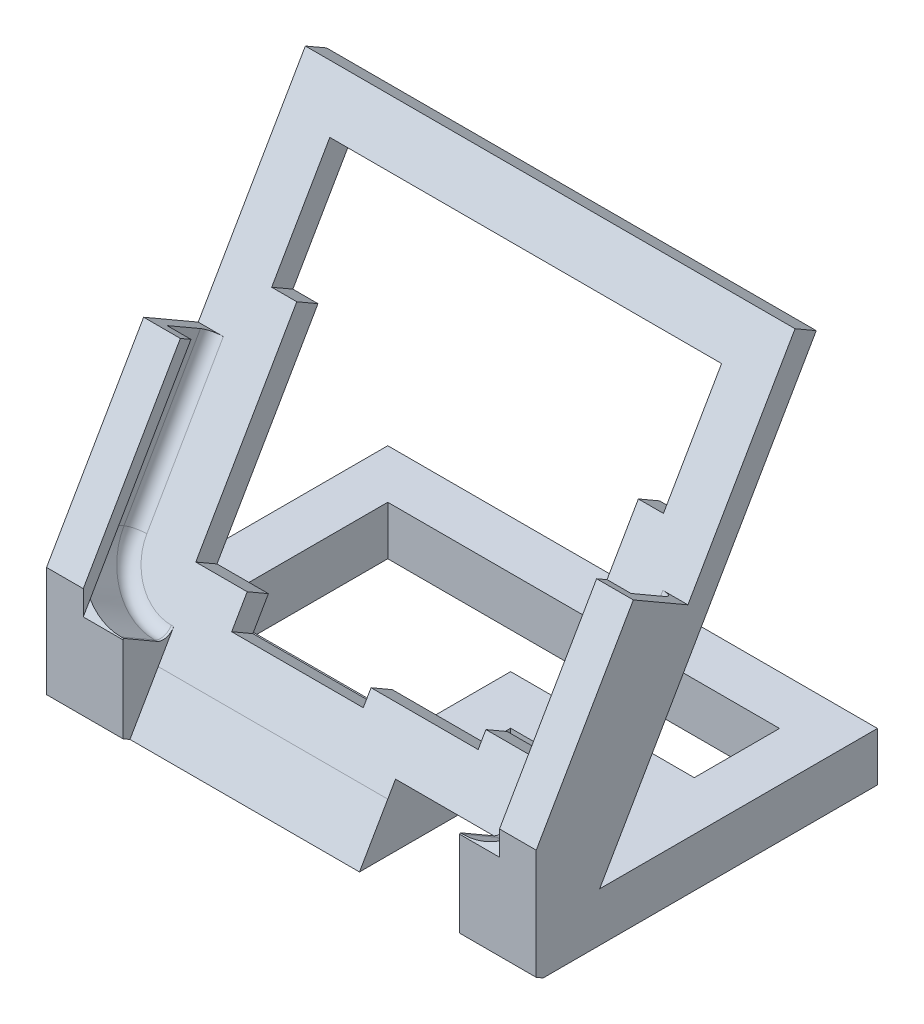
from build123d import *
from OCP.BRepFilletAPI import BRepFilletAPI_MakeChamfer

# Parameters (mm, degrees)
SKETCH1_W           = 80
SKETCH1_H           = 50
BOSS_EXTRUDE1_DEPTH = 8
BOSS_EXTRUDE2_DEPTH = 80
SKETCH3_W           = 2.1
SKETCH3_H           = 35
BOSS_EXTRUDE3_DEPTH = 8.3
FILLET1_R           = 10
FILLET2_R           = 2
BOSS_EXTRUDE4_DEPTH = 10
CHAMFER2_SIZE       = 17.320508076
CHAMFER2_SIZE_2     = 10
SKETCH5_W           = 12.5
SKETCH5_H           = 9.237604307
BOSS_EXTRUDE5_DEPTH = 8.3
SKETCH6_W           = 6
SKETCH6_H           = 47.309401077
BOSS_EXTRUDE6_DEPTH = 2
CHAMFER3_SIZE       = 9
CHAMFER3_SIZE2      = 15.588457268
SKETCH7_W           = 17.5
SKETCH7_H           = 11.773502692
CUT_EXTRUDE1_DEPTH  = 12
SKETCH8_W           = 17.5
SKETCH8_H           = 15
CUT_EXTRUDE2_DEPTH  = 12
CUT_EXTRUDE3_DEPTH  = 12
CUT_EXTRUDE4_DEPTH  = 4


with BuildPart() as part:
    # Sketch1 → Boss-Extrude1 (new body)
    with BuildSketch(Plane(origin=(0, 0, 0), x_dir=(1, 0, 0), z_dir=(0, 1, 0))):
        Rectangle(SKETCH1_W, SKETCH1_H)
    extrude(amount=BOSS_EXTRUDE1_DEPTH)

    # Sketch2 → Boss-Extrude2 (add)
    with BuildSketch(Plane(origin=(40, 0, 0), x_dir=(0, 0, -1), z_dir=(1, 0, 0))):
        Polygon((15, 69.282032303), (11.535898385, 71.282032303), (-25, 8), (-20.381197846, 8), align=None)
    extrude(amount=-BOSS_EXTRUDE2_DEPTH)

    # Sketch3 → Boss-Extrude3 (add)
    with BuildSketch(Plane(origin=(0, 12.825317547, 22.214101615), x_dir=(1, 0, 0), z_dir=(0, 0.5000000000000041, 0.8660254037844364))):
        with Locations((-38.95, 15)):
            Rectangle(SKETCH3_W, SKETCH3_H)
        Polygon((-27.5, -5.57179677), (-27.5, -2.5), (-37.9, -2.5), (-40, -2.5), (-40, -5.57179677), align=None)
        Polygon((40, -5.57179677), (40, -2.5), (37.9, -2.5), (27.5, -2.5), (27.5, -5.57179677), align=None)
        with Locations((38.95, 15)):
            Rectangle(SKETCH3_W, SKETCH3_H)
    extrude(amount=BOSS_EXTRUDE3_DEPTH)

    # Fillet1
    fillet1_edges = [part.edges().sort_by_distance(p)[0] for p in [
        (-37.9, 12.735254038, 27.058107041),
        (37.9, 12.735254038, 27.058107041),
    ]]
    fillet(fillet1_edges, radius=FILLET1_R)

    # Fillet2
    fillet2_edges = [part.edges().sort_by_distance(p)[0] for p in [
        (-27.7, 10.660254038, 23.464101615),
        (-37.9, 30.145825623, 12.214101615),
        (27.7, 10.660254038, 23.464101615),
        (37.9, 30.145825623, 12.214101615),
        (34.971067812, 13.196783719, 21.999635521),
        (-34.971067812, 13.196783719, 21.999635521),
    ]]
    fillet(fillet2_edges, radius=FILLET2_R)

    # Sketch4 → Boss-Extrude4 (add)
    with BuildSketch(Plane.XY.offset(25)):
        Polygon((40, 0), (40, 8), (27.5, 8), (-27.5, 8), (-40, 8), (-40, 0), align=None)
    extrude(amount=BOSS_EXTRUDE4_DEPTH)

    # Chamfer2
    # the kernel refuses this chamfer: 17.320508076, 10 mm, written as the material it takes off along each edge
    with BuildSketch(Plane(origin=(-84.809639706, 8, 35), x_dir=(0, -0.999813220622208, 0.019326765612700497), z_dir=(1, 0, 0))) as chamfer2_piece_1:
        Polygon((CHAMFER2_SIZE * 0.999813220604, CHAMFER2_SIZE * 0.0193267656124), (-CHAMFER2_SIZE_2 * 0.0193267656127, CHAMFER2_SIZE_2 * 0.999813220622), (0, 0), align=None)
    extrude(amount=169.619279412, mode=Mode.SUBTRACT)

    # Sketch5 → Boss-Extrude5 (add)
    with BuildSketch(Plane(origin=(0, 12.825317547, 22.214101615), x_dir=(1, 0, 0), z_dir=(0, 0.49999999999999656, 0.8660254037844407))):
        with Locations((-33.75, -10.190598924)):
            Rectangle(SKETCH5_W, SKETCH5_H)
        with Locations((33.75, -10.190598924)):
            Rectangle(SKETCH5_W, SKETCH5_H)
    extrude(amount=BOSS_EXTRUDE5_DEPTH)

    # Sketch6 → Boss-Extrude6 (add)
    with BuildSketch(Plane(origin=(0, 16.975317547, 29.402112467), x_dir=(1, 0, 0), z_dir=(0, 0.5000000000000041, 0.8660254037844364))):
        with Locations((-37, 8.845299461)):
            Rectangle(SKETCH6_W, SKETCH6_H)
        with Locations((37, 8.845299461)):
            Rectangle(SKETCH6_W, SKETCH6_H)
    extrude(amount=BOSS_EXTRUDE6_DEPTH)

    # Chamfer3: one chamfer whose edges measure the first distance from different faces: ONE call of the kernel's chamfer builder (chamfer() names one face for all edges)
    chamfer3_edges_1 = [part.edges().sort_by_distance(p)[0] for p in [
        (-37, 5.15, 38.538863812),
    ]]
    chamfer3_side_1 = [part.faces().sort_by_distance(p)[0] for p in [
        (-34.086933045, 2.341954644, 33.675186585),
    ]]
    chamfer3_edges_2 = [part.edges().sort_by_distance(p)[0] for p in [
        (37, 5.15, 38.538863812),
    ]]
    chamfer3_side_2 = [part.faces().sort_by_distance(p)[0] for p in [
        (34.086933045, 2.341954644, 33.675186585),
    ]]
    chamfer3 = BRepFilletAPI_MakeChamfer(part.part.solid().wrapped)
    for e in chamfer3_edges_1:
        chamfer3.Add(CHAMFER3_SIZE, CHAMFER3_SIZE2, e.wrapped, chamfer3_side_1[0].wrapped)  # the first distance lies on this face
    for e in chamfer3_edges_2:
        chamfer3.Add(CHAMFER3_SIZE, CHAMFER3_SIZE2, e.wrapped, chamfer3_side_2[0].wrapped)  # the first distance lies on this face
    add(Compound.cast(chamfer3.Shape()), mode=Mode.REPLACE)

    # Sketch7 → Cut-Extrude1 (cut)
    with BuildSketch(Plane(origin=(0, 12.825317547, 22.214101615), x_dir=(1, 0, 0), z_dir=(0, 0.49999999999999656, 0.8660254037844407))):
        with Locations((18.75, -8.922649731)):
            Rectangle(SKETCH7_W, SKETCH7_H)
    extrude(amount=-CUT_EXTRUDE1_DEPTH, mode=Mode.SUBTRACT)

    # Sketch8 → Cut-Extrude2 (cut)
    with BuildSketch(Plane(origin=(0, 8, 0), x_dir=(1, 0, 0), z_dir=(0, 1, 0))):
        with Locations((18.75, -12.42820323)):
            Rectangle(SKETCH8_W, SKETCH8_H)
    extrude(amount=-CUT_EXTRUDE2_DEPTH, mode=Mode.SUBTRACT)

    # Sketch9 → Cut-Extrude3 (cut)
    with BuildSketch(Plane(origin=(0, 8, 0), x_dir=(1, 0, 0), z_dir=(0, 1, 0))):
        Polygon((-32, -12.381197846), (2, -12.381197846), (2, 3.07179677), (32, 3.07179677), (32, 17), (-32, 17), align=None)
    extrude(amount=-CUT_EXTRUDE3_DEPTH, mode=Mode.SUBTRACT)

    # Sketch10 → Cut-Extrude4 (cut)
    with BuildSketch(Plane(origin=(0, 12.825317547, 22.214101615), x_dir=(1, 0, 0), z_dir=(0, 0.500000000000004, 0.8660254037844365))):
        Polygon((-19.5, 7.5), (-19.5, 2.42820323), (2, 2.42820323), (2, 4.964101615), (19.5, 4.964101615), (19.5, 7.5), (27.9, 7.5), (27.9, 40.5), (32, 40.5), (32, 59.5), (-32, 59.5), (-32, 40.5), (-27.9, 40.5), (-27.9, 7.5), align=None)
    extrude(amount=-CUT_EXTRUDE4_DEPTH, mode=Mode.SUBTRACT)


solid = part.part
